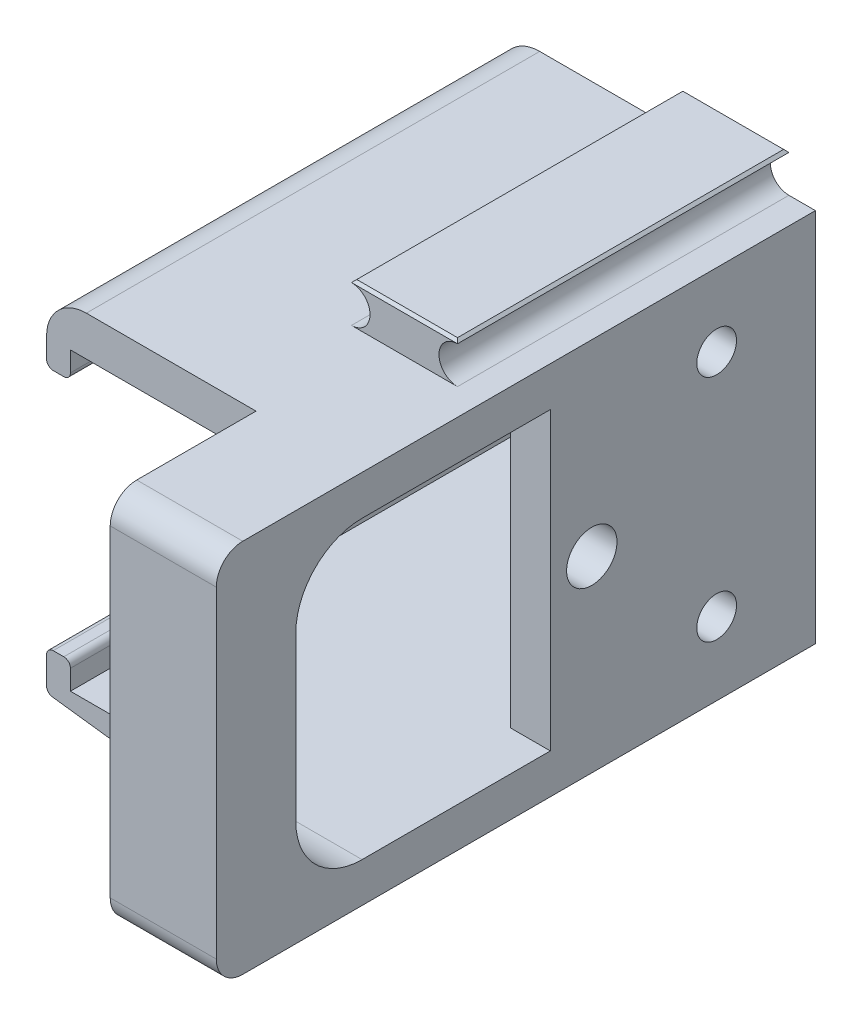
from build123d import *

# Parameters (mm, degrees)
BOSS_EXTRUDE1_DEPTH      = 3
BOSS_EXTRUDE1_DEPTH_BACK = 5
SKETCH2_W                = 20
SKETCH2_H                = 28.3
SKETCH2_R                = 1.9
BOSS_EXTRUDE2_DEPTH      = 3
CUT_EXTRUDE1_REACH       = 43.342
AGUJEROSMOTOR_R          = 1.5
SKETCH5_W                = 34.2
SKETCH5_H                = 3
BOSS_EXTRUDE3_DEPTH      = 15.8
CROQUIS1_W               = 1.8
CROQUIS1_H               = 34.2
SALIENTE_EXTRUIR1_DEPTH  = 2
CROQUIS3_W               = 8
CROQUIS3_H               = 25
SALIENTE_EXTRUIR2_DEPTH  = 3
CHAFL_N2_SIZE            = 0.2
CORTAR_EXTRUIR1_DEPTH    = 42.824992528
CHAFL_N3_SIZE            = 2
CHAFL_N3_SIZE2           = 15.8
REDONDEO3_R              = 0.5
REDONDEO4_R              = 0.5
REDONDEO5_R              = 3


with BuildPart() as part:
    # U → Boss-Extrude1 (new, two sides: drawn at the far end of the back side and taken through both)
    with BuildSketch(Plane(origin=(0, 0, 0), x_dir=(0, 0, -1), z_dir=(1, 0, 0)).offset(-BOSS_EXTRUDE1_DEPTH_BACK)):
        with BuildLine():
            Line((12, 20.3), (12, 23.3))
            Line((12, 23.3), (-31.2, 23.3))
            ThreePointArc((-31.2, 23.3), (-32.614213562, 22.714213562), (-33.2, 21.3))
            Line((-33.2, 21.3), (-33.2, -3))
            ThreePointArc((-33.2, -3), (-32.614213562, -4.414213562), (-31.2, -5))
            Line((-31.2, -5), (12, -5))
            Line((12, -5), (12, -2))
            Line((12, -2), (-22.2, -2))
            ThreePointArc((-22.2, -2), (-25.735533906, -0.535533906), (-27.2, 3))
            Line((-27.2, 3), (-27.2, 15.3))
            ThreePointArc((-27.2, 15.3), (-25.735533906, 18.835533906), (-22.2, 20.3))
            Line((-22.2, 20.3), (12, 20.3))
        make_face()
    extrude(amount=BOSS_EXTRUDE1_DEPTH + BOSS_EXTRUDE1_DEPTH_BACK)

    # Sketch2 → Boss-Extrude2 (add)
    with BuildSketch(Plane(origin=(0, 0, 0), x_dir=(0, 0, -1), z_dir=(1, 0, 0))):
        with Locations((2, 9.15)):
            Rectangle(SKETCH2_W, SKETCH2_H)
        with Locations((-4.87, 9.15)):
            Circle(SKETCH2_R, mode=Mode.SUBTRACT)
    extrude(amount=BOSS_EXTRUDE2_DEPTH)

    # AgujerosMotor → Cut-Extrude1 (cut, up to next)
    with BuildSketch(Plane(origin=(3, 0, 0), x_dir=(0, 0, -1), z_dir=(1, 0, 0)), mode=Mode.PRIVATE) as cut_extrude1_sk1:
        with Locations((4.55, 0.5)):
            Circle(AGUJEROSMOTOR_R)
    cut_extrude1_tool1 = extrude(cut_extrude1_sk1.sketch, amount=-CUT_EXTRUDE1_REACH, mode=Mode.PRIVATE) & part.part
    # AgujerosMotor → Cut-Extrude1 (cut, up to next)
    with BuildSketch(Plane(origin=(3, 0, 0), x_dir=(0, 0, -1), z_dir=(1, 0, 0)), mode=Mode.PRIVATE) as cut_extrude1_sk2:
        with Locations((4.55, 17.8)):
            Circle(AGUJEROSMOTOR_R)
    cut_extrude1_tool2 = extrude(cut_extrude1_sk2.sketch, amount=-CUT_EXTRUDE1_REACH, mode=Mode.PRIVATE) & part.part
    add(cut_extrude1_tool1.solids().sort_by_distance((3, 0.5, -4.55))[0], mode=Mode.SUBTRACT)
    add(cut_extrude1_tool2.solids().sort_by_distance((3, 17.8, -4.55))[0], mode=Mode.SUBTRACT)

    # Sketch5 → Boss-Extrude3 (add)
    with BuildSketch(Plane.ZY.offset(5)):
        with Locations((5.1, 21.8)):
            Rectangle(SKETCH5_W, SKETCH5_H)
    boss_extrude3 = extrude(amount=BOSS_EXTRUDE3_DEPTH)

    # Croquis1 → Saliente-Extruir1 (add)
    with BuildSketch(Plane.XZ.offset(-20.3)):
        with Locations((-19.9, 5.1)):
            Rectangle(CROQUIS1_W, CROQUIS1_H)
    saliente_extruir1 = extrude(amount=SALIENTE_EXTRUIR1_DEPTH)

    # Croquis3 → Saliente-Extruir2 (add)
    with BuildSketch(Plane(origin=(0, 23.3, 0), x_dir=(1, 0, 0), z_dir=(0, 1, 0))):
        with Locations((-3, -0.5)):
            Rectangle(CROQUIS3_W, CROQUIS3_H)
    extrude(amount=SALIENTE_EXTRUIR2_DEPTH)

    # Chaflán2
    chafl_n2_edges = [part.edges().sort_by_distance(p)[0] for p in [
        (-3, 26.3, -12),
        (-7, 26.3, 0.5),
        (-3, 26.3, 13),
        (1, 26.3, 0.5),
    ]]
    chamfer(chafl_n2_edges, length=CHAFL_N2_SIZE)

    # Croquis7 → Cortar-Extruir1 (cut, through all)
    with BuildSketch(Plane.XY.offset(13)):
        with BuildLine():
            Line((1, 26.1), (1, 23.3))
            ThreePointArc((1, 23.3), (-0.4, 24.7), (1, 26.1))
        make_face()
        with BuildLine():
            Line((-7, 23.3), (-7, 26.1))
            ThreePointArc((-7, 26.1), (-5.6, 24.7), (-7, 23.3))
        make_face()
    extrude(amount=-CORTAR_EXTRUIR1_DEPTH, mode=Mode.SUBTRACT)

    # Simetría11: Boss-Extrude3 across plane
    add(boss_extrude3.mirror(Plane.ZX.offset(9.15)))

    # Chaflán3
    chafl_n3_edges = [part.edges().sort_by_distance(p)[0] for p in [
        (-20.8, -5, 5.1),
    ]]
    chafl_n3_side = [part.faces().sort_by_distance(p)[0] for p in [
        (-20.8, -3.5, 5.1),
    ]]
    chamfer(chafl_n3_edges, length=CHAFL_N3_SIZE, length2=CHAFL_N3_SIZE2, reference=chafl_n3_side[0])

    # Simetría14: Saliente-Extruir1 across plane
    add(saliente_extruir1.mirror(Plane.ZX.offset(9.15)))

    # Redondeo3
    redondeo3_edges = [part.edges().sort_by_distance(p)[0] for p in [
        (-20.8, -3, 5.1),
        (-19, 0, 5.1),
        (-20.8, 0, 5.1),
    ]]
    fillet(redondeo3_edges, radius=REDONDEO3_R)

    # Redondeo4
    redondeo4_edges = [part.edges().sort_by_distance(p)[0] for p in [
        (-19, 18.3, 5.1),
        (-20.8, 18.3, 5.1),
    ]]
    fillet(redondeo4_edges, radius=REDONDEO4_R)

    # Redondeo5
    redondeo5_edges = [part.edges().sort_by_distance(p)[0] for p in [
        (-20.8, 23.3, 5.1),
    ]]
    fillet(redondeo5_edges, radius=REDONDEO5_R)


solid = part.part
